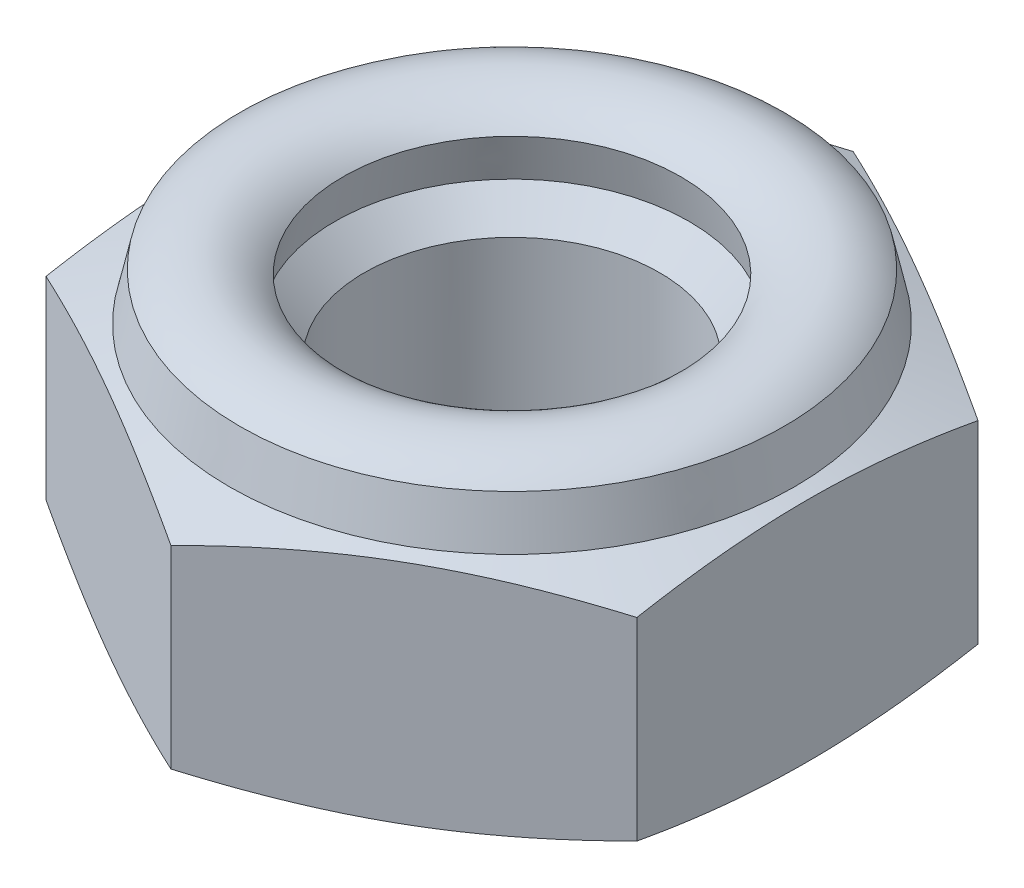
from build123d import *

# Parameters (mm, degrees)
EXTRUDE_1_DEPTH              = 1.6
HOLE_WIZARD_M2_1_D           = 1.6
HOLE_WIZARD_M2_1_DEPTH       = 6
HOLE_WIZARD_M2_1_CBORE_D     = 2
HOLE_WIZARD_M2_1_CBORE_DEPTH = 4
HOLE_WIZARD_M2_1_TIP         = 0.480688495
CHAMFER_1_SIZE               = 0.2


with BuildPart() as part:
    # 草图1 → 拉伸1 (new body)
    with BuildSketch(Plane(origin=(0, 0, 0), x_dir=(1, 0, 0), z_dir=(0, 1, 0))):
        Polygon((0, -2.309401077), (2, -1.154700538), (2, 1.154700538), (0, 2.309401077), (-2, 1.154700538), (-2, -1.154700538), align=None)
    extrude(amount=EXTRUDE_1_DEPTH)

    # M2 螺纹孔1
    with Locations(Plane(origin=(0, 1.6, 0), x_dir=(-1, 0, 0), z_dir=(0, 1, 0))):
        with Locations((0, 0)):
            CounterBoreHole(HOLE_WIZARD_M2_1_D / 2, HOLE_WIZARD_M2_1_CBORE_D / 2, HOLE_WIZARD_M2_1_CBORE_DEPTH, depth=HOLE_WIZARD_M2_1_DEPTH)
            with Locations((0, 0, -(HOLE_WIZARD_M2_1_DEPTH + HOLE_WIZARD_M2_1_TIP / 2))):  # 118° drill point
                Cone(0, HOLE_WIZARD_M2_1_D / 2, HOLE_WIZARD_M2_1_TIP, mode=Mode.SUBTRACT)

    # 草图4 → 切除-旋转2 (revolve, cut)
    with BuildSketch(Plane(origin=(0, 0, 0), x_dir=(0, 0, -1), z_dir=(1, 0, 0))):
        Polygon((1.9124112, 0), (2.309401077, 0.144492499), (2.309401077, 0), align=None)
        Polygon((2.309401077, 1.6), (2.309401077, 1.455507501), (1.9124112, 1.6), align=None)
    revolve(axis=Axis((0, 3.026713328, 0), (0, -1, 0)), mode=Mode.SUBTRACT)

    # 倒角1
    chamfer_1_edges = [part.edges().sort_by_distance(p)[0] for p in [
        (1, 1.6, 0),
        (1, 0, 0),
    ]]
    chamfer(chamfer_1_edges, length=CHAMFER_1_SIZE)

    # 草图5 → 旋转1 (revolve)
    with BuildSketch(Plane.XY):
        with BuildLine():
            Line((1.9124112, 1.6), (1.2, 1.6))
            Line((1.2, 1.6), (1.143418513, 1.890796389))
            ThreePointArc((1.143418513, 1.890796389), (1.487091006, 2.040622043), (1.841671491, 1.918838677))
            Line((1.841671491, 1.918838677), (1.9124112, 1.6))
        make_face()
    revolve(axis=Axis((0, 0, 0), (0, 1, 0)))


solid = part.part
